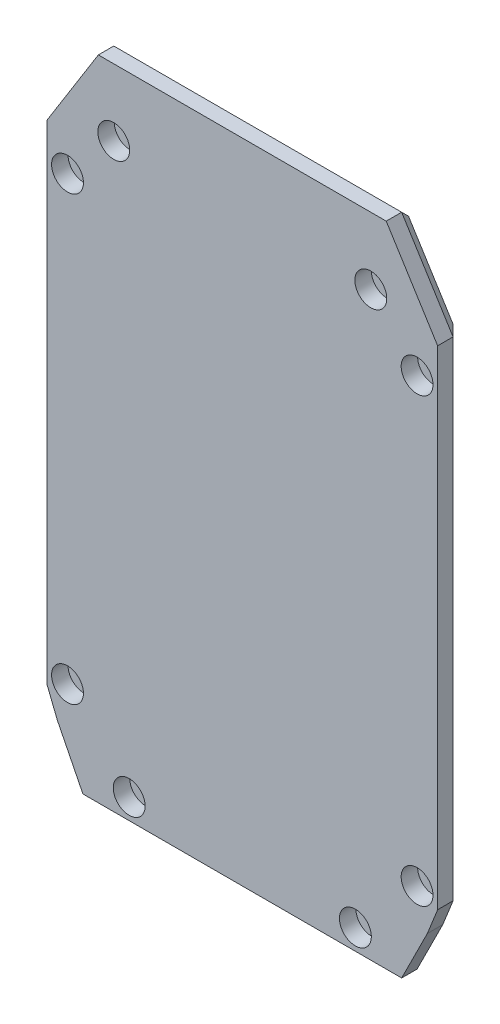
from build123d import *

# Parameters (mm, degrees)
EXTRUDE_246_DEPTH       = 6
CHAMFER_C3_SIZE         = 3
CUT_EXTRUDE_9_1P5_DEPTH = 1.5
CUT_EXTRUDE_1P5_DEPTH   = 1.5
CUT_EXTRUDE_START       = 2.8
SKETCH_4_R              = 3.1
CUT_EXTRUDE_2P8_DEPTH   = 3.2


with BuildPart() as part:
    # 草图1 → Extrude 246 (new body)
    with BuildSketch(Plane.XY):
        Polygon((-31, -60), (31, -60), (36, -50), (38, -45), (38, 50), (28, 66), (-28, 66), (-38, 50), (-38, -45), (-36, -50), align=None)
    extrude(amount=EXTRUDE_246_DEPTH)

    # 橡胶垫全周向心倒角_C3
    # the kernel refuses this chamfer: 3 mm, written as the material it takes off along each edge
    with BuildSketch(Plane(origin=(-40.865297253, -37.836756868, 0), x_dir=(-0.025529280528386825, -0.01021171221135473, 0.9996219169112968), z_dir=(0.3713906763541037, -0.9284766908852594, 0)), Plane(origin=(33.134702747, -57.163243132, 0), x_dir=(0.025529280528386825, -0.01021171221135473, 0.9996219169112968), z_dir=(0.3713906763541037, 0.9284766908852594, 0))) as chamfer_c3_piece_1:
        Polygon((CHAMFER_C3_SIZE * 0.999621916911, -CHAMFER_C3_SIZE * 0.0274958766106), (-CHAMFER_C3_SIZE * 0.0274958766106, -CHAMFER_C3_SIZE * 0.999621916911), (0, 0), align=None)
    extrude(amount=20.815262735, mode=Mode.SUBTRACT)
    with BuildSketch(Plane(origin=(-38, 57.715048964, 0), x_dir=(-0.027495876610586778, 0, 0.9996219169112968), z_dir=(0, -1, 0)), Plane(origin=(38, -52.715048964, 0), x_dir=(0.027495876610586778, 0, 0.9996219169112968), z_dir=(0, 1, 0))) as chamfer_c3_piece_2:
        Polygon((CHAMFER_C3_SIZE * 0.999621916911, -CHAMFER_C3_SIZE * 0.0274958766106), (-CHAMFER_C3_SIZE * 0.0274958766106, -CHAMFER_C3_SIZE * 0.999621916911), (0, 0), align=None)
    extrude(amount=110.430097928, mode=Mode.SUBTRACT)
    with BuildSketch(Plane(origin=(-23.911032227, 72.542348437, 0), x_dir=(-0.023316456732911096, 0.014572785458069436, 0.9996219169112968), z_dir=(-0.52999894000318, -0.847998304005088, 0)), Plane(origin=(42.088967773, 43.457651563, 0), x_dir=(0.02331645673290944, 0.014572785458068402, 0.9996219169112968), z_dir=(-0.52999894000318, 0.847998304005088, 0))) as chamfer_c3_piece_3:
        Polygon((CHAMFER_C3_SIZE * 0.999621916911, -CHAMFER_C3_SIZE * 0.0274958766106), (-CHAMFER_C3_SIZE * 0.0274958766106, -CHAMFER_C3_SIZE * 0.999621916911), (0, 0), align=None)
    extrude(amount=34.298060192, mode=Mode.SUBTRACT)
    with BuildSketch(Plane(origin=(35.715048964, 66, 0), x_dir=(0, 0.027495876610586778, 0.9996219169112968), z_dir=(-1, 0, 0))) as chamfer_c3_piece_4:
        Polygon((CHAMFER_C3_SIZE * 0.999621916911, -CHAMFER_C3_SIZE * 0.0274958766106), (-CHAMFER_C3_SIZE * 0.0274958766106, -CHAMFER_C3_SIZE * 0.999621916911), (0, 0), align=None)
    extrude(amount=71.430097928, mode=Mode.SUBTRACT)
    with BuildSketch(Plane(origin=(27.549725213, -66.900549573, 0), x_dir=(0.024593059680886438, -0.012296529840443219, 0.9996219169112968), z_dir=(0.447213595499958, 0.894427190999916, 0)), Plane(origin=(-39.450274787, -43.099450427, 0), x_dir=(-0.024593059680884596, -0.012296529840442298, 0.9996219169112968), z_dir=(0.447213595499958, -0.894427190999916, 0))) as chamfer_c3_piece_5:
        Polygon((CHAMFER_C3_SIZE * 0.999621916911, -CHAMFER_C3_SIZE * 0.0274958766106), (-CHAMFER_C3_SIZE * 0.0274958766106, -CHAMFER_C3_SIZE * 0.999621916911), (0, 0), align=None)
    extrude(amount=26.610437815, mode=Mode.SUBTRACT)
    with BuildSketch(Plane(origin=(-38.715048964, -60, 0), x_dir=(0, -0.027495876610586778, 0.9996219169112968), z_dir=(1, 0, 0))) as chamfer_c3_piece_6:
        Polygon((CHAMFER_C3_SIZE * 0.999621916911, -CHAMFER_C3_SIZE * 0.0274958766106), (-CHAMFER_C3_SIZE * 0.0274958766106, -CHAMFER_C3_SIZE * 0.999621916911), (0, 0), align=None)
    extrude(amount=77.430097928, mode=Mode.SUBTRACT)

    # 草图2 → 鞋底横向等距防滑槽_节距9_深1p5 (cut)
    with BuildSketch(Plane.XY):
        with BuildLine():
            Line((-28.9, -46.1), (28.9, -46.1))
            ThreePointArc((28.9, -46.1), (30, -45), (28.9, -43.9))
            Line((28.9, -43.9), (-28.9, -43.9))
            ThreePointArc((-28.9, -43.9), (-30, -45), (-28.9, -46.1))
        make_face()
        with BuildLine():
            Line((-28.9, -37.1), (28.9, -37.1))
            ThreePointArc((28.9, -37.1), (30, -36), (28.9, -34.9))
            Line((28.9, -34.9), (-28.9, -34.9))
            ThreePointArc((-28.9, -34.9), (-30, -36), (-28.9, -37.1))
        make_face()
        with BuildLine():
            Line((-28.9, -28.1), (28.9, -28.1))
            ThreePointArc((28.9, -28.1), (30, -27), (28.9, -25.9))
            Line((28.9, -25.9), (-28.9, -25.9))
            ThreePointArc((-28.9, -25.9), (-30, -27), (-28.9, -28.1))
        make_face()
        with BuildLine():
            Line((-28.9, -19.1), (28.9, -19.1))
            ThreePointArc((28.9, -19.1), (30, -18), (28.9, -16.9))
            Line((28.9, -16.9), (-28.9, -16.9))
            ThreePointArc((-28.9, -16.9), (-30, -18), (-28.9, -19.1))
        make_face()
        with BuildLine():
            Line((-28.9, -10.1), (28.9, -10.1))
            ThreePointArc((28.9, -10.1), (30, -9), (28.9, -7.9))
            Line((28.9, -7.9), (-28.9, -7.9))
            ThreePointArc((-28.9, -7.9), (-30, -9), (-28.9, -10.1))
        make_face()
        with BuildLine():
            Line((-28.9, -1.1), (28.9, -1.1))
            ThreePointArc((28.9, -1.1), (30, 0), (28.9, 1.1))
            Line((28.9, 1.1), (-28.9, 1.1))
            ThreePointArc((-28.9, 1.1), (-30, 0), (-28.9, -1.1))
        make_face()
        with BuildLine():
            Line((-28.9, 7.9), (28.9, 7.9))
            ThreePointArc((28.9, 7.9), (30, 9), (28.9, 10.1))
            Line((28.9, 10.1), (-28.9, 10.1))
            ThreePointArc((-28.9, 10.1), (-30, 9), (-28.9, 7.9))
        make_face()
        with BuildLine():
            Line((-28.9, 16.9), (28.9, 16.9))
            ThreePointArc((28.9, 16.9), (30, 18), (28.9, 19.1))
            Line((28.9, 19.1), (-28.9, 19.1))
            ThreePointArc((-28.9, 19.1), (-30, 18), (-28.9, 16.9))
        make_face()
        with BuildLine():
            Line((-28.9, 25.9), (28.9, 25.9))
            ThreePointArc((28.9, 25.9), (30, 27), (28.9, 28.1))
            Line((28.9, 28.1), (-28.9, 28.1))
            ThreePointArc((-28.9, 28.1), (-30, 27), (-28.9, 25.9))
        make_face()
        with BuildLine():
            Line((-28.9, 34.9), (28.9, 34.9))
            ThreePointArc((28.9, 34.9), (30, 36), (28.9, 37.1))
            Line((28.9, 37.1), (-28.9, 37.1))
            ThreePointArc((-28.9, 37.1), (-30, 36), (-28.9, 34.9))
        make_face()
        with BuildLine():
            Line((-28.9, 43.9), (28.9, 43.9))
            ThreePointArc((28.9, 43.9), (30, 45), (28.9, 46.1))
            Line((28.9, 46.1), (-28.9, 46.1))
            ThreePointArc((-28.9, 46.1), (-30, 45), (-28.9, 43.9))
        make_face()
        with BuildLine():
            Line((-28.9, 52.9), (28.9, 52.9))
            ThreePointArc((28.9, 52.9), (30, 54), (28.9, 55.1))
            Line((28.9, 55.1), (-28.9, 55.1))
            ThreePointArc((-28.9, 55.1), (-30, 54), (-28.9, 52.9))
        make_face()
    extrude(amount=CUT_EXTRUDE_9_1P5_DEPTH, mode=Mode.SUBTRACT)

    # 草图3 → 鞋底纵向分区槽_深1p5 (cut)
    with BuildSketch(Plane.XY):
        with BuildLine():
            Line((-14.1, -46), (-13.9, -46))
            ThreePointArc((-13.9, -46), (-13.192893219, -45.707106781), (-12.9, -45))
            Line((-12.9, -45), (-12.9, 51))
            ThreePointArc((-12.9, 51), (-13.192893219, 51.707106781), (-13.9, 52))
            Line((-13.9, 52), (-14.1, 52))
            ThreePointArc((-14.1, 52), (-14.807106781, 51.707106781), (-15.1, 51))
            Line((-15.1, 51), (-15.1, -45))
            ThreePointArc((-15.1, -45), (-14.807106781, -45.707106781), (-14.1, -46))
        make_face()
        with BuildLine():
            Line((13.9, -46), (14.1, -46))
            ThreePointArc((14.1, -46), (14.807106781, -45.707106781), (15.1, -45))
            Line((15.1, -45), (15.1, 51))
            ThreePointArc((15.1, 51), (14.807106781, 51.707106781), (14.1, 52))
            Line((14.1, 52), (13.9, 52))
            ThreePointArc((13.9, 52), (13.192893219, 51.707106781), (12.9, 51))
            Line((12.9, 51), (12.9, -45))
            ThreePointArc((12.9, -45), (13.192893219, -45.707106781), (13.9, -46))
        make_face()
    extrude(amount=CUT_EXTRUDE_1P5_DEPTH, mode=Mode.SUBTRACT)

    # 草图4 → 底部螺钉头背面避让_保留2p8底厚 (cut)
    with BuildSketch(Plane.XY.offset(CUT_EXTRUDE_START)):
        with Locations((-22, -56)):
            Circle(SKETCH_4_R)
        with Locations((-25, 53)):
            Circle(SKETCH_4_R)
        with Locations((-34, -43)):
            Circle(SKETCH_4_R)
        with Locations((-34, 43)):
            Circle(SKETCH_4_R)
        with Locations((22, -56)):
            Circle(SKETCH_4_R)
        with Locations((25, 53)):
            Circle(SKETCH_4_R)
        with Locations((34, -43)):
            Circle(SKETCH_4_R)
        with Locations((34, 43)):
            Circle(SKETCH_4_R)
    extrude(amount=CUT_EXTRUDE_2P8_DEPTH, mode=Mode.SUBTRACT)


solid = part.part
